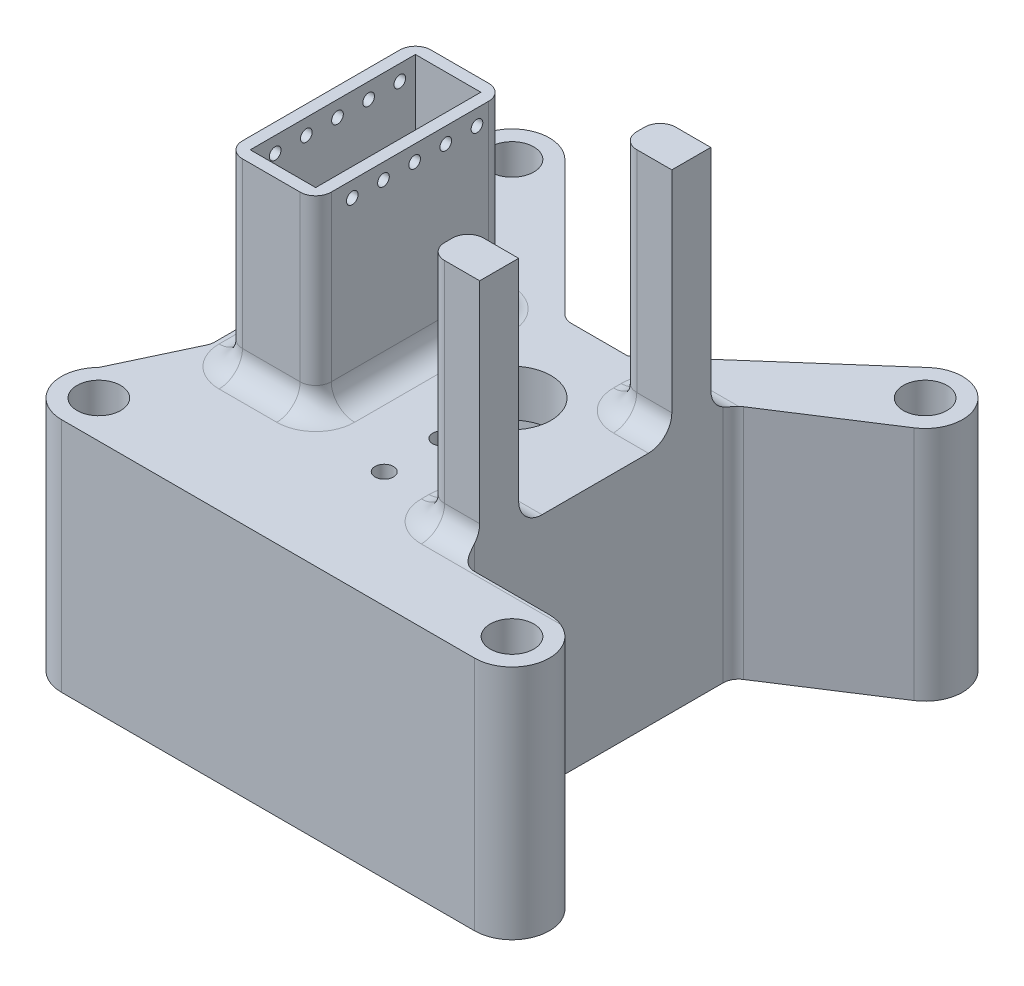
from build123d import *
from build123d.topology import SkipClean

# Parameters (mm, degrees)
SKETCH3_R           = 3.556
BOSS_EXTRUDE1_DEPTH = 21.463
SKETCH4_R           = 3.556
BOSS_EXTRUDE2_DEPTH = 7.366
SKETCH5_R           = 3.556
SKETCH5_R_2         = 6.35
BOSS_EXTRUDE3_DEPTH = 7.62
SKETCH6_W           = 14.478
SKETCH6_H           = 30.734
BOSS_EXTRUDE4_DEPTH = 30.59
SKETCH7_W           = 10.668
SKETCH7_H           = 26.924
CUT_EXTRUDE1_DEPTH  = 50.8
SKETCH8_R           = 0.9525
CUT_EXTRUDE2_DEPTH  = 104.085463514
SKETCH10_W          = 8.255
SKETCH10_H          = 6.35
BOSS_EXTRUDE5_DEPTH = 38.1
SKETCH13_R          = 1.5
CUT_EXTRUDE4_DEPTH  = 4.000000128
FILLET1_R           = 2.54
FILLET2_R           = 3.81
BOSS_EXTRUDE6_START = 2.058500074
SKETCH14_R          = 3.556
BOSS_EXTRUDE6_DEPTH = 2.058500074


with BuildPart() as part:
    # Sketch3 → Boss-Extrude1 (new body)
    with BuildSketch(Plane(origin=(0, 0, 0), x_dir=(1, 0, 0), z_dir=(0, 1, 0))):
        with BuildLine():
            Line((-33.675960454, -39.771960454), (33.675960454, -39.771960454))
            ThreePointArc((33.675960454, -39.771960454), (39.771960454, -33.675960454), (33.675960454, -27.579960454))
            Line((33.675960454, -27.579960454), (18.923, -27.579960454))
            Line((18.923, -27.579960454), (18.923, 16.870039546))
            Line((18.923, 16.870039546), (36.987426386, 28.557815343))
            ThreePointArc((36.987426386, 28.557815343), (38.539435093, 37.351260501), (29.656332864, 38.25895184))
            Line((29.656332864, 38.25895184), (3.556, 15.367))
            Line((3.556, 15.367), (3.556, 10.033))
            Line((3.556, 10.033), (10.033, 10.033))
            Line((10.033, 10.033), (10.033, -30.099))
            Line((10.033, -30.099), (-10.033, -30.099))
            Line((-10.033, -30.099), (-10.033, 10.033))
            Line((-10.033, 10.033), (-3.556, 10.033))
            Line((-3.556, 10.033), (-3.556, 15.367))
            Line((-3.556, 15.367), (-6.731, 15.367))
            Line((-6.731, 15.367), (-29.366862115, 37.987907521))
            ThreePointArc((-29.366862115, 37.987907521), (-36.009729137, 39.307544577), (-39.771960454, 33.675960454))
            ThreePointArc((-39.771960454, 33.675960454), (-39.691421033, 32.688311717), (-39.451930917, 31.726760309))
            Line((-39.451930917, 31.726760309), (-32.131, 10.033))
            Line((-32.131, 10.033), (-32.131, -16.891))
            Line((-32.131, -16.891), (-37.986483392, -29.365437516))
            ThreePointArc((-37.986483392, -29.365437516), (-39.307930084, -31.34312225), (-39.771960454, -33.675960454))
            ThreePointArc((-39.771960454, -33.675960454), (-37.986483392, -37.986483392), (-33.675960454, -39.771960454))
        make_face()
        with Locations((-33.675960454, 33.675960454)):
            Circle(SKETCH3_R, mode=Mode.SUBTRACT)
        with Locations((33.675960454, 33.675960454)):
            Circle(SKETCH3_R, mode=Mode.SUBTRACT)
        with Locations((33.675960454, -33.675960454)):
            Circle(SKETCH3_R, mode=Mode.SUBTRACT)
        with Locations((-33.675960454, -33.675960454)):
            Circle(SKETCH3_R, mode=Mode.SUBTRACT)
    extrude(amount=BOSS_EXTRUDE1_DEPTH)

    # Sketch4 → Boss-Extrude2 (add)
    with BuildSketch(Plane(origin=(0, 21.463, 0), x_dir=(1, 0, 0), z_dir=(0, 1, 0))):
        with BuildLine():
            Line((3.556, 15.367), (-3.556, 15.367))
            Line((-3.556, 15.367), (-6.731, 15.367))
            Line((-6.731, 15.367), (-29.366862115, 37.987907521))
            ThreePointArc((-29.366862115, 37.987907521), (-36.891301736, 38.855033386), (-39.451930917, 31.726760309))
            Line((-39.451930917, 31.726760309), (-32.131, 10.033))
            Line((-32.131, 10.033), (-32.131, -16.891))
            Line((-32.131, -16.891), (-37.986483392, -29.365437516))
            ThreePointArc((-37.986483392, -29.365437516), (-39.307930084, -36.008798658), (-33.675960454, -39.771960454))
            Line((-33.675960454, -39.771960454), (33.675960454, -39.771960454))
            ThreePointArc((33.675960454, -39.771960454), (39.771960454, -33.675960454), (33.675960454, -27.579960454))
            Line((33.675960454, -27.579960454), (18.923, -27.579960454))
            Line((18.923, -27.579960454), (18.923, 16.870039546))
            Line((18.923, 16.870039546), (36.987426386, 28.557815343))
            ThreePointArc((36.987426386, 28.557815343), (38.539435093, 37.351260501), (29.656332864, 38.25895184))
            Line((29.656332864, 38.25895184), (3.556, 15.367))
        make_face()
        with Locations((33.675960454, -33.675960454)):
            Circle(SKETCH4_R, mode=Mode.SUBTRACT)
        with Locations((33.675960454, 33.675960454)):
            Circle(SKETCH4_R, mode=Mode.SUBTRACT)
        with Locations((-33.675960454, 33.675960454)):
            Circle(SKETCH4_R, mode=Mode.SUBTRACT)
        with Locations((-33.675960454, -33.675960454)):
            Circle(SKETCH4_R, mode=Mode.SUBTRACT)
        Polygon((-3.556, 10.033), (3.556, 10.033), (10.033, 10.033), (10.033, -30.099), (-10.033, -30.099), (-10.033, 10.033), align=None, mode=Mode.SUBTRACT)
    extrude(amount=BOSS_EXTRUDE2_DEPTH)

    # Sketch5 → Boss-Extrude3 (add)
    with BuildSketch(Plane(origin=(0, 28.829, 0), x_dir=(1, 0, 0), z_dir=(0, 1, 0))):
        with BuildLine():
            Line((3.556, 15.367), (-6.731, 15.367))
            Line((-6.731, 15.367), (-29.366862115, 37.987907521))
            ThreePointArc((-29.366862115, 37.987907521), (-36.891301736, 38.855033386), (-39.451930917, 31.726760309))
            Line((-39.451930917, 31.726760309), (-32.131, 10.033))
            Line((-32.131, 10.033), (-32.131, -16.891))
            Line((-32.131, -16.891), (-37.986483392, -29.365437516))
            ThreePointArc((-37.986483392, -29.365437516), (-39.307930084, -36.008798658), (-33.675960454, -39.771960454))
            Line((-33.675960454, -39.771960454), (33.675960454, -39.771960454))
            ThreePointArc((33.675960454, -39.771960454), (39.771960454, -33.675960454), (33.675960454, -27.579960454))
            Line((33.675960454, -27.579960454), (18.923, -27.579960454))
            Line((18.923, -27.579960454), (18.923, 16.870039546))
            Line((18.923, 16.870039546), (36.987426386, 28.557815343))
            ThreePointArc((36.987426386, 28.557815343), (38.539435093, 37.351260501), (29.656332864, 38.25895184))
            Line((29.656332864, 38.25895184), (3.556, 15.367))
        make_face()
        with Locations((33.675960454, 33.675960454)):
            Circle(SKETCH5_R, mode=Mode.SUBTRACT)
        with Locations((-33.675960454, 33.675960454)):
            Circle(SKETCH5_R, mode=Mode.SUBTRACT)
        with Locations((-33.675960454, -33.675960454)):
            Circle(SKETCH5_R, mode=Mode.SUBTRACT)
        with Locations((33.675960454, -33.675960454)):
            Circle(SKETCH5_R, mode=Mode.SUBTRACT)
        Circle(SKETCH5_R_2, mode=Mode.SUBTRACT)
    extrude(amount=BOSS_EXTRUDE3_DEPTH)

    # Sketch6 → Boss-Extrude4 (add)
    with BuildSketch(Plane(origin=(0, 36.449, 0), x_dir=(1, 0, 0), z_dir=(0, 1, 0))):
        with Locations((-20.447, -3.429)):
            Rectangle(SKETCH6_W, SKETCH6_H)
    extrude(amount=BOSS_EXTRUDE4_DEPTH)

    # Sketch7 → Cut-Extrude1 (cut)
    with BuildSketch(Plane(origin=(0, 67.039, 0), x_dir=(1, 0, 0), z_dir=(0, 1, 0))):
        with Locations((-20.447, -3.429)):
            Rectangle(SKETCH7_W, SKETCH7_H)
    extrude(amount=-CUT_EXTRUDE1_DEPTH, mode=Mode.SUBTRACT)

    # Sketch8 → Cut-Extrude2 (cut, through all)
    with BuildSketch(Plane.ZY.offset(27.686)):
        with Locations((-7.493, 64.499)):
            Circle(SKETCH8_R)
        with Locations((-2.413, 64.499)):
            Circle(SKETCH8_R)
        with Locations((2.667, 64.499)):
            Circle(SKETCH8_R)
        with Locations((7.747, 64.499)):
            Circle(SKETCH8_R)
        with Locations((12.827, 64.499)):
            Circle(SKETCH8_R)
    extrude(amount=-CUT_EXTRUDE2_DEPTH, mode=Mode.SUBTRACT)

    # Sketch10 → Boss-Extrude5 (add)
    with BuildSketch(Plane(origin=(0, 36.449, 0), x_dir=(1, 0, 0), z_dir=(0, 1, 0))):
        with Locations((14.7955, -21.014960454)):
            Rectangle(SKETCH10_W, SKETCH10_H)
        with Locations((14.7955, 10.305039546)):
            Rectangle(SKETCH10_W, SKETCH10_H)
    extrude(amount=BOSS_EXTRUDE5_DEPTH)

    # Sketch13 → Cut-Extrude4 (cut)
    with BuildSketch(Plane(origin=(0, 36.449, 0), x_dir=(1, 0, 0), z_dir=(0, 1, 0))):
        with Locations((0, -11.43)):
            Circle(SKETCH13_R)
        with Locations((0, -20.828)):
            Circle(SKETCH13_R)
    extrude(amount=-CUT_EXTRUDE4_DEPTH, mode=Mode.SUBTRACT)

    # Fillet1
    fillet1_edges = [part.edges().sort_by_distance(p)[0] for p in [
        (10.668, 55.499, 17.839960454),
        (10.668, 55.499, 24.189960454),
        (10.668, 55.499, -7.130039546),
        (10.668, 55.499, -13.480039546),
        (-27.686, 51.744, -11.938),
        (-13.208, 51.744, -11.938),
        (-13.208, 51.744, 18.796),
        (-27.686, 51.744, 18.796),
        (-32.131, 18.2245, 16.891),
        (-32.131, 18.2245, -10.033),
        (-6.731, 18.2245, -15.367),
        (18.923, 18.2245, -16.870039546),
        (18.923, 18.2245, 27.579960454),
    ]]
    fillet(fillet1_edges, radius=FILLET1_R)

    # Fillet2
    fillet2_edges = [part.edges().sort_by_distance(p)[0] for p in [
        (-13.951948776, 36.449, -11.194051224),
        (-13.208, 36.449, 3.429),
        (-13.951948776, 36.449, 18.052051224),
        (-20.447, 36.449, 18.796),
        (-26.942051224, 36.449, 18.052051224),
        (-27.686, 36.449, 3.429),
        (-26.942051224, 36.449, -11.194051224),
        (16.0655, 36.449, 24.189960454),
        (11.411948776, 36.449, 23.446011678),
        (10.668, 36.449, 21.014960454),
        (11.411948776, 36.449, 18.58390923),
        (16.0655, 36.449, -7.130039546),
        (11.411948776, 36.449, -7.873988322),
        (10.668, 36.449, -10.305039546),
        (11.411948776, 36.449, -12.73609077),
        (-20.447, 36.449, -11.938),
        (16.0655, 36.449, 17.839960454),
        (16.0655, 36.449, -13.480039546),
    ]]
    fillet(fillet2_edges, radius=FILLET2_R)

    # Sketch14 → Boss-Extrude6 (add)
    with SkipClean():  # the faces are left unmerged after this step: merging them gives an invalid solid
        with BuildSketch(Plane.XZ.offset(BOSS_EXTRUDE6_START)):
            with BuildLine():
                Line((-3.556, -10.033), (-10.033, -10.033))
                Line((-10.033, -10.033), (-10.033, 30.099))
                Line((-10.033, 30.099), (10.033, 30.099))
                Line((10.033, 30.099), (10.033, -10.033))
                Line((10.033, -10.033), (3.556, -10.033))
                Line((3.556, -10.033), (3.556, -15.367))
                Line((3.556, -15.367), (29.656332864, -38.25895184))
                ThreePointArc((29.656332864, -38.25895184), (38.539435093, -37.351260501), (36.987426386, -28.557815343))
                Line((36.987426386, -28.557815343), (20.083222528, -17.620709426))
                ThreePointArc((20.083222528, -17.620709426), (19.231830489, -16.702019883), (18.923, -15.488148963))
                Line((18.923, -15.488148963), (18.923, 25.039960454))
                ThreePointArc((18.923, 25.039960454), (19.666948776, 26.836011678), (21.463, 27.579960454))
                Line((21.463, 27.579960454), (33.675960454, 27.579960454))
                ThreePointArc((33.675960454, 27.579960454), (39.771960454, 33.675960454), (33.675960454, 39.771960454))
                Line((33.675960454, 39.771960454), (-33.675960454, 39.771960454))
                ThreePointArc((-33.675960454, 39.771960454), (-39.307930084, 36.008798658), (-37.986483392, 29.365437516))
                Line((-37.986483392, 29.365437516), (-32.371707745, 17.403800315))
                ThreePointArc((-32.371707745, 17.403800315), (-32.191907189, 16.877416157), (-32.131, 16.324515771))
                Line((-32.131, 16.324515771), (-32.131, -9.615969956))
                ThreePointArc((-32.131, -9.615969956), (-32.164558092, -10.027490263), (-32.26434564, -10.428136683))
                Line((-32.26434564, -10.428136683), (-39.451930917, -31.726760309))
                ThreePointArc((-39.451930917, -31.726760309), (-36.891301736, -38.855033386), (-29.366862115, -37.987907521))
                Line((-29.366862115, -37.987907521), (-7.474846818, -16.110355389))
                ThreePointArc((-7.474846818, -16.110355389), (-6.651017369, -15.560185424), (-5.679389177, -15.367))
                Line((-5.679389177, -15.367), (-3.556, -15.367))
                Line((-3.556, -15.367), (-3.556, -10.033))
            make_face()
            with Locations((-33.675960454, -33.675960454)):
                Circle(SKETCH14_R, mode=Mode.SUBTRACT)
            with Locations((-33.675960454, 33.675960454)):
                Circle(SKETCH14_R, mode=Mode.SUBTRACT)
            with Locations((33.675960454, 33.675960454)):
                Circle(SKETCH14_R, mode=Mode.SUBTRACT)
            with Locations((33.675960454, -33.675960454)):
                Circle(SKETCH14_R, mode=Mode.SUBTRACT)
        extrude(amount=-BOSS_EXTRUDE6_DEPTH)


solid = part.part
